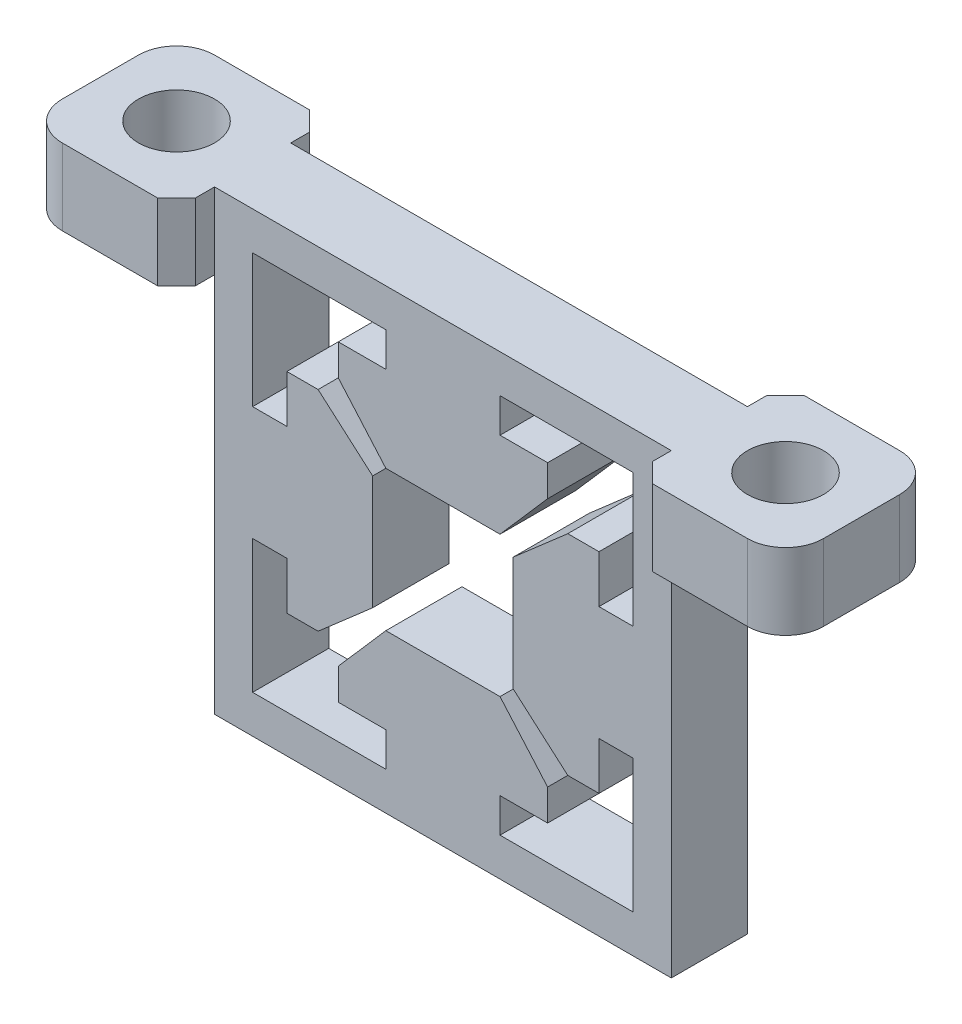
from build123d import *

# Parameters (mm, degrees)
SKETCH_1_W                 = 24
SKETCH_1_H                 = 24
EXTRUDE_1_DEPTH            = 4
SKETCH_6_R                 = 2
EXTRUDE_2_DEPTH            = 4
CHAMFER_1_SIZE             = 1
CHAMFER_1_OF_MIRROR_1_SIZE = 1


with BuildPart() as part:
    # Эскиз1 → Бобышка-Вытянуть1 (new body)
    with BuildSketch(Plane.XY):
        Rectangle(SKETCH_1_W, SKETCH_1_H)
        Polygon((3, 8.2), (3, 10), (10, 10), (10, 3), (8.2, 3), (8.2, 5.5), (6.56, 5.5), (3.693992791, 3), (3.693992791, -3), (6.56, -5.5), (8.2, -5.5), (8.2, -3), (10, -3), (10, -10), (3, -10), (3, -8.2), (5.5, -8.2), (5.5, -6.56), (3, -3.693992791), (-3, -3.693992791), (-5.5, -6.56), (-5.5, -8.2), (-3, -8.2), (-3, -10), (-10, -10), (-10, -3), (-8.2, -3), (-8.2, -5.5), (-6.56, -5.5), (-3.693992791, -3), (-3.693992791, 3), (-6.56, 5.5), (-8.2, 5.5), (-8.2, 3), (-10, 3), (-10, 10), (-3, 10), (-3, 8.2), (-5.5, 8.2), (-5.5, 6.56), (-3, 3.693992791), (3, 3.693992791), (5.5, 6.56), (5.5, 8.2), align=None, mode=Mode.SUBTRACT)
    extrude(amount=EXTRUDE_1_DEPTH)

    # Эскиз6 → Бобышка-Вытянуть2 (add)
    with BuildSketch(Plane(origin=(0, 12, 0), x_dir=(1, 0, 0), z_dir=(0, 1, 0))):
        with BuildLine():
            Line((-12, 2), (-18, 2))
            ThreePointArc((-18, 2), (-19.414213562, 1.414213562), (-20, 0))
            Line((-20, 0), (-20, -4))
            ThreePointArc((-20, -4), (-19.414213562, -5.414213562), (-18, -6))
            Line((-18, -6), (-12, -6))
            Line((-12, -6), (-12, 2))
        make_face()
        with Locations((-16, -2)):
            Circle(SKETCH_6_R, mode=Mode.SUBTRACT)
    extrude_2 = extrude(amount=-EXTRUDE_2_DEPTH)

    # Фаска1
    chamfer_1_edges = [part.edges().sort_by_distance(p)[0] for p in [
        (-12, 10, -2),
        (-12, 10, 6),
    ]]
    chamfer(chamfer_1_edges, length=CHAMFER_1_SIZE)

    # Зеркальное отражение1: Бобышка-Вытянуть2 across plane
    add(extrude_2.mirror(Plane(origin=(0, 0, 0), x_dir=(0, 0, 1), z_dir=(1, 0, 0))))

    # Фаска1 of Зеркальное отражение1
    chamfer_1_of_mirror_1_edges = [part.edges().sort_by_distance(p)[0] for p in [
        (12, 10, -2),
        (12, 10, 6),
    ]]
    chamfer(chamfer_1_of_mirror_1_edges, length=CHAMFER_1_OF_MIRROR_1_SIZE)


solid = part.part
